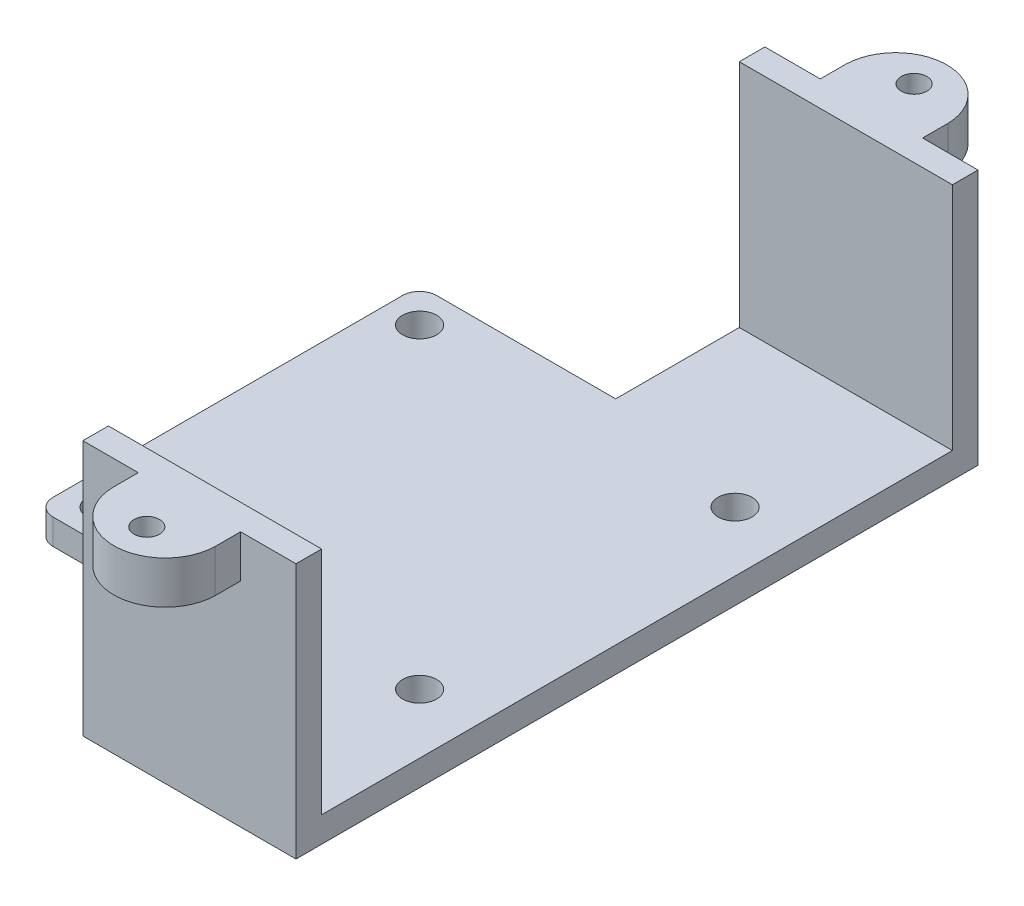
from build123d import *

# Parameters (mm, degrees)
EXTRUDE_1_OUTLINE_W = 25
EXTRUDE_1_OUTLINE_H = 80
EXTRUDE_1_DEPTH     = 30
SKETCH_2_W          = 74
SKETCH_2_H          = 27
CUT_EXTRUDE_1_DEPTH = 33
SKETCH_3_R          = 1.5
EXTRUDE_2_DEPTH     = 5
SKETCH_4_R          = 2
EXTRUDE_3_DEPTH     = 3
SKETCH_5_R          = 2
CUT_EXTRUDE_2_DEPTH = 3


# Read off the part's stored shape, not the designer's step: 填料-伸長1
with BuildPart() as part:
    # 填料-伸長1 outline → 填料-伸長1 (new body)
    with BuildSketch(Plane.XZ.offset(-131.641882403)):
        with Locations((29.792094012, -19.915289206)):
            Rectangle(EXTRUDE_1_OUTLINE_W, EXTRUDE_1_OUTLINE_H)
    extrude(amount=EXTRUDE_1_DEPTH)

    # 草圖2 → 除料-伸長1 (cut)
    with BuildSketch(Plane(origin=(42.292094012, 0, 0), x_dir=(0, 0, -1), z_dir=(1, 0, 0))):
        with Locations((19.915289206, 118.141882403)):
            Rectangle(SKETCH_2_W, SKETCH_2_H)
    extrude(amount=-CUT_EXTRUDE_1_DEPTH, mode=Mode.SUBTRACT)

    # 草圖3 → 填料-伸長2 (add)
    # profile 1 of 2: a face of its own
    with BuildSketch(Plane.XZ.offset(-131.641882403)):
        with BuildLine():
            Line((23.792094012, 20.084710794), (35.792094012, 20.084710794))
            Line((35.792094012, 20.084710794), (35.792094012, 23.084710794))
            ThreePointArc((35.792094012, 23.084710794), (29.792094012, 28.938496633), (23.792094012, 23.084710794))
            Line((23.792094012, 23.084710794), (23.792094012, 20.084710794))
        make_face()
        with Locations(Location((29.792094012, 25.084710794, 0), (0, 0, 270))):
            Circle(SKETCH_3_R, mode=Mode.SUBTRACT)
    # profile 2 of 2: a face of its own
    with BuildSketch(Plane.XZ.offset(-131.641882403)):
        with BuildLine():
            Line((23.792094012, -62.915289206), (23.792094012, -59.915289206))
            Line((23.792094012, -59.915289206), (35.792094012, -59.915289206))
            Line((35.792094012, -59.915289206), (35.792094012, -62.915289206))
            ThreePointArc((35.792094012, -62.915289206), (29.792094012, -68.769075045), (23.792094012, -62.915289206))
        make_face()
        with Locations(Location((29.792094012, -64.915289206, 0), (0, 0, 90))):
            Circle(SKETCH_3_R, mode=Mode.SUBTRACT)
    extrude(amount=EXTRUDE_2_DEPTH)

    # 草圖4 → 填料-伸長3 (add)
    with BuildSketch(Plane.XZ.offset(-101.641882403)):
        with BuildLine():
            Line((17.292094012, 2.584710794), (-3.707905988, 2.584710794))
            ThreePointArc((-3.707905988, 2.584710794), (-5.12211955, 1.998924356), (-5.707905988, 0.584710794))
            Line((-5.707905988, 0.584710794), (-5.707905988, -40.415289206))
            ThreePointArc((-5.707905988, -40.415289206), (-5.12211955, -41.829502769), (-3.707905988, -42.415289206))
            Line((-3.707905988, -42.415289206), (17.292094012, -42.415289206))
            Line((17.292094012, -42.415289206), (17.292094012, 2.584710794))
        make_face()
        with Locations(Location((-1.707905988, -38.415289206, 0), (0, 0, 270))):
            Circle(SKETCH_4_R, mode=Mode.SUBTRACT)
        with Locations(Location((-1.707905988, -1.415289206, 0), (0, 0, 270))):
            Circle(SKETCH_4_R, mode=Mode.SUBTRACT)
    extrude(amount=-EXTRUDE_3_DEPTH)

    # 草圖5 → 除料-伸長2 (cut)
    with BuildSketch(Plane.XZ.offset(-101.641882403)):
        with Locations(Location((35.292094012, -1.415289206, 0), (0, 0, 270))):
            Circle(SKETCH_5_R)
        with Locations(Location((35.292094012, -38.415289206, 0), (0, 0, 270))):
            Circle(SKETCH_5_R)
    extrude(amount=-CUT_EXTRUDE_2_DEPTH, mode=Mode.SUBTRACT)


solid = part.part
